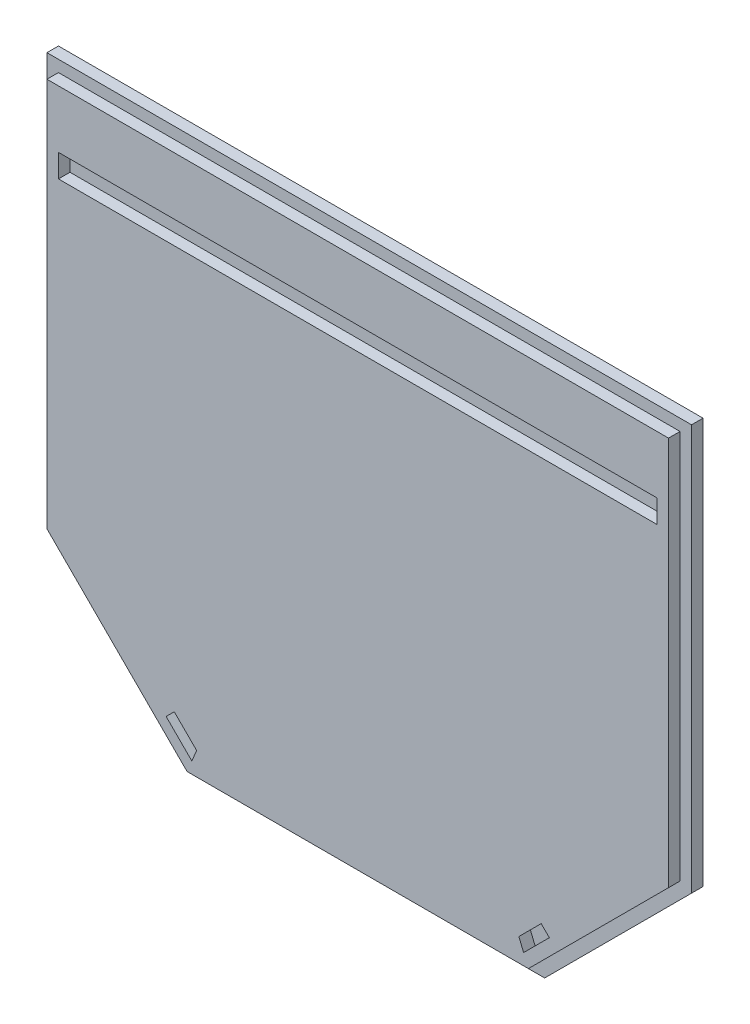
from build123d import *

# Parameters (mm, degrees)
BOSS_EXTRUDE1_DEPTH = 12.7
SKETCH2_W           = 330.2
SKETCH2_H           = 12.7
CUT_EXTRUDE1_DEPTH  = 6.35
CUT_EXTRUDE3_DEPTH  = 6.35


with BuildPart() as part:
    # Sketch1 → Boss-Extrude1 (new body)
    with BuildSketch(Plane.XY):
        Polygon((0, 0), (355.6, 0), (355.6, -223.774), (292.534512242, -286.839487758), (274.574, -304.8), (81.026, -304.8), (63.065487758, -286.839487758), (0, -223.774), align=None)
    extrude(amount=BOSS_EXTRUDE1_DEPTH)

    # Sketch2 → Cut-Extrude1 (cut)
    # profile 1 of 2: a face of its own
    with BuildSketch(Plane.XY.offset(12.7)):
        Polygon((355.6, 0), (0, 0), (0, -223.774), (81.026, -304.8), (274.574, -304.8), (355.6, -223.774), align=None)
        Polygon((83.656256121, -298.45), (6.35, -221.143743879), (6.35, -6.35), (349.25, -6.35), (349.25, -221.143743879), (271.943743879, -298.45), align=None, mode=Mode.SUBTRACT)
    # profile 2 of 2: a face of its own
    with BuildSketch(Plane.XY.offset(12.7)):
        with Locations((177.8, -44.45)):
            Rectangle(SKETCH2_W, SKETCH2_H)
    extrude(amount=-CUT_EXTRUDE1_DEPTH, mode=Mode.SUBTRACT)

    # Sketch3 → Cut-Extrude3 (cut)
    with BuildSketch(Plane.XY.offset(12.7)):
        Polygon((86.286512242, -292.1), (72.097707571, -277.911195329), (76.587835631, -273.421067268), (88.916768363, -285.75), align=None)
        Polygon((283.502292429, -277.911195329), (279.012164369, -273.421067268), (266.683231637, -285.75), (269.313487758, -292.1), align=None)
    extrude(amount=-CUT_EXTRUDE3_DEPTH, mode=Mode.SUBTRACT)


solid = part.part
